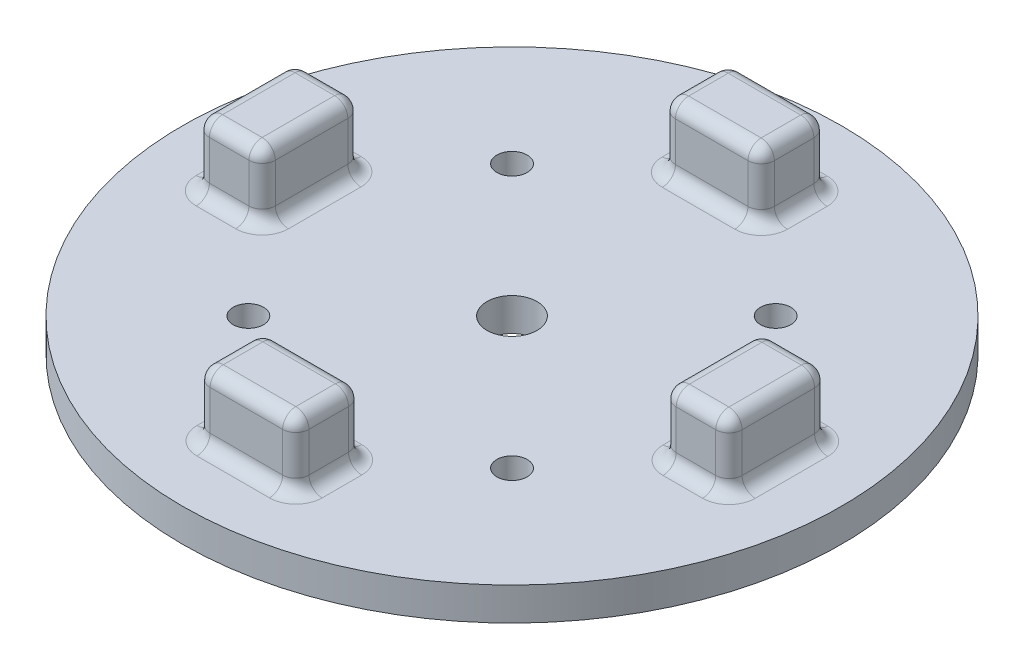
from build123d import *

# Parameters (mm, degrees)
SKETCH2_R           = 63.5
SKETCH2_R_2         = 2.921
SKETCH2_R_3         = 4.826
BOSS_EXTRUDE2_DEPTH = 6.35
SKETCH3_W           = 19.05
SKETCH3_H           = 12.7
SKETCH3_W_2         = 12.7
SKETCH3_H_2         = 19.05
BOSS_EXTRUDE3_DEPTH = 12.7
FILLET1_R           = 2.54


with BuildPart() as part:
    # Sketch2 → Boss-Extrude2 (new body)
    with BuildSketch(Plane(origin=(0, 0, 0), x_dir=(1, 0, 0), z_dir=(0, 1, 0))):
        Circle(SKETCH2_R)
        with Locations((-25.4, 25.4)):
            Circle(SKETCH2_R_2, mode=Mode.SUBTRACT)
        with Locations((25.4, 25.4)):
            Circle(SKETCH2_R_2, mode=Mode.SUBTRACT)
        with Locations((25.4, -25.4)):
            Circle(SKETCH2_R_2, mode=Mode.SUBTRACT)
        with Locations((-25.4, -25.4)):
            Circle(SKETCH2_R_2, mode=Mode.SUBTRACT)
        Circle(SKETCH2_R_3, mode=Mode.SUBTRACT)
    extrude(amount=BOSS_EXTRUDE2_DEPTH)

    # Sketch3 → Boss-Extrude3 (add)
    with BuildSketch(Plane(origin=(0, 6.35, 0), x_dir=(1, 0, 0), z_dir=(0, 1, 0))):
        with Locations((0, 44.831)):
            Rectangle(SKETCH3_W, SKETCH3_H)
        with Locations((0, -44.831)):
            Rectangle(SKETCH3_W, SKETCH3_H)
        with Locations((-44.971451378, 0)):
            Rectangle(SKETCH3_W_2, SKETCH3_H_2)
        with Locations((44.971451378, 0)):
            Rectangle(SKETCH3_W_2, SKETCH3_H_2)
    extrude(amount=BOSS_EXTRUDE3_DEPTH)

    # Fillet1
    fillet1_edges = [part.edges().sort_by_distance(p)[0] for p in [
        (51.321451378, 6.35, 0),
        (44.971451378, 6.35, -9.525),
        (44.971451378, 6.35, 9.525),
        (38.621451378, 12.7, -9.525),
        (38.621451378, 19.05, 0),
        (38.621451378, 12.7, 9.525),
        (38.621451378, 6.35, 0),
        (51.321451378, 12.7, 9.525),
        (51.321451378, 12.7, -9.525),
        (-51.321451378, 12.7, -9.525),
        (-51.321451378, 12.7, 9.525),
        (-38.621451378, 12.7, 9.525),
        (-38.621451378, 12.7, -9.525),
        (9.525, 12.7, 51.181),
        (9.525, 12.7, 38.481),
        (-9.525, 12.7, 38.481),
        (-9.525, 12.7, 51.181),
        (9.525, 12.7, -38.481),
        (-9.525, 12.7, -38.481),
        (9.525, 12.7, -51.181),
        (-9.525, 12.7, -51.181),
        (0, 6.35, 51.181),
        (-44.971451378, 6.35, 9.525),
        (0, 6.35, -38.481),
        (9.525, 6.35, 44.831),
        (-9.525, 6.35, 44.831),
        (-38.621451378, 6.35, 0),
        (-51.321451378, 6.35, 0),
        (9.525, 6.35, -44.831),
        (-9.525, 6.35, -44.831),
        (0, 19.05, 38.481),
        (0, 6.35, 38.481),
        (-44.971451378, 6.35, -9.525),
        (0, 6.35, -51.181),
        (51.321451378, 19.05, 0),
        (44.971451378, 19.05, 9.525),
        (44.971451378, 19.05, -9.525),
        (-51.321451378, 19.05, 0),
        (0, 19.05, -51.181),
        (0, 19.05, 51.181),
        (9.525, 19.05, 44.831),
        (-9.525, 19.05, 44.831),
        (-44.971451378, 19.05, 9.525),
        (-38.621451378, 19.05, 0),
        (-44.971451378, 19.05, -9.525),
        (9.525, 19.05, -44.831),
        (-9.525, 19.05, -44.831),
        (0, 19.05, -38.481),
    ]]
    fillet(fillet1_edges, radius=FILLET1_R)


solid = part.part
